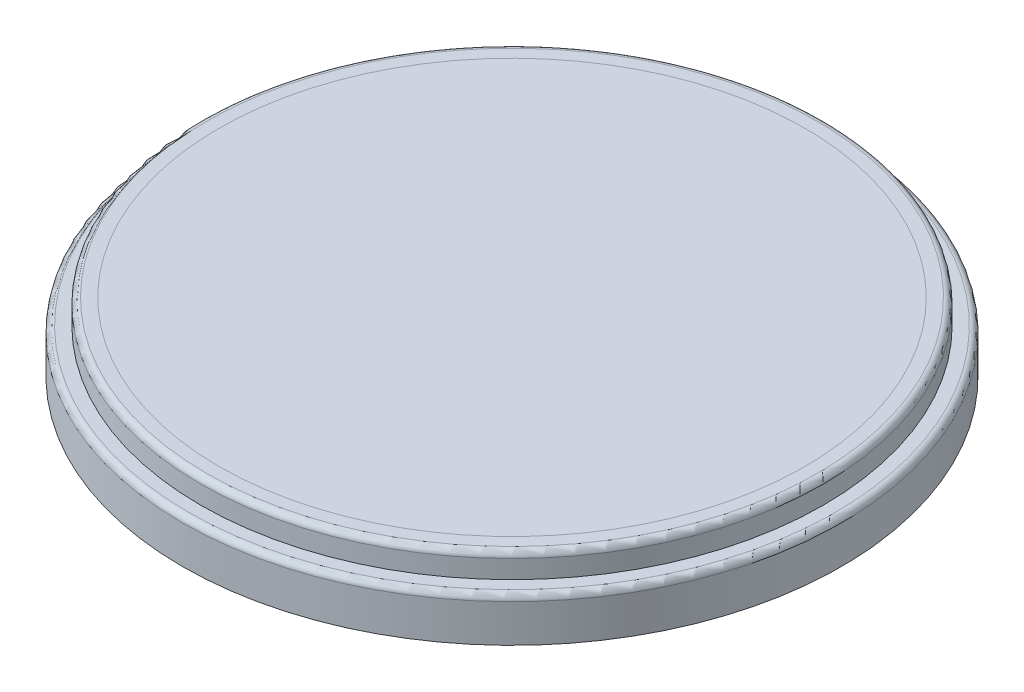
from build123d import *

# Parameters (mm, degrees)
SKETCH1_R           = 27
SKETCH1_R_2         = 25.5
BOSS_EXTRUDE1_DEPTH = 3.6
SKETCH2_R           = 25.5
SKETCH2_R_2         = 24
BOSS_EXTRUDE2_DEPTH = 2
FILLET2_R           = 0.5
FILLET4_R           = 0.5
SKETCH3_R           = 24
BOSS_EXTRUDE4_DEPTH = 1


with BuildPart() as part:
    # Sketch1 → Boss-Extrude1 (new body)
    with BuildSketch(Plane(origin=(0, 0, 0), x_dir=(1, 0, 0), z_dir=(0, 1, 0))):
        Circle(SKETCH1_R)
        Circle(SKETCH1_R_2, mode=Mode.SUBTRACT)
    extrude(amount=BOSS_EXTRUDE1_DEPTH)

    # Fillet4
    fillet4_edges = [part.edges().sort_by_distance(p)[0] for p in [
        (-27, 3.6, 0),
    ]]
    fillet(fillet4_edges, radius=FILLET4_R)


with BuildPart() as body_2:
    # Sketch2 → Boss-Extrude2 (new body)
    with BuildSketch(Plane(origin=(0, 3.6, 0), x_dir=(1, 0, 0), z_dir=(0, 1, 0))):
        Circle(SKETCH2_R)
        Circle(SKETCH2_R_2, mode=Mode.SUBTRACT)
    extrude(amount=BOSS_EXTRUDE2_DEPTH)

    # Fillet2
    fillet2_edges = [body_2.edges().sort_by_distance(p)[0] for p in [
        (-24, 3.6, 0),
        (-25.5, 5.6, 0),
    ]]
    fillet(fillet2_edges, radius=FILLET2_R)


with BuildPart() as body_3:
    # Sketch3 → Boss-Extrude4 (new body)
    with BuildSketch(Plane(origin=(0, 5.6, 0), x_dir=(1, 0, 0), z_dir=(0, 1, 0))):
        Circle(SKETCH3_R)
    extrude(amount=-BOSS_EXTRUDE4_DEPTH)


solid = Compound([part.part, body_2.part, body_3.part])
